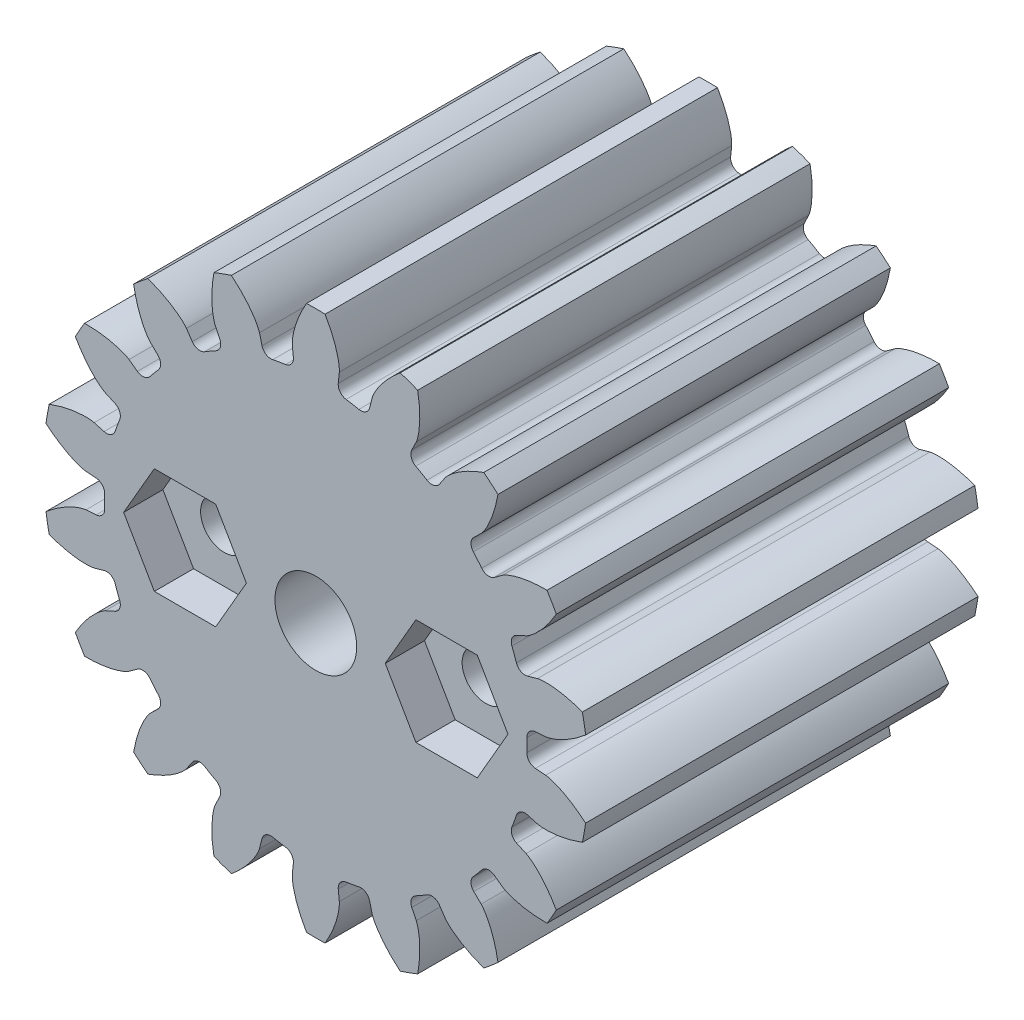
from build123d import *

# Parameters (mm, degrees)
SKETCH3_R                = 10.583333333
BOSS_EXTRUDE1_DEPTH      = 15.24
CUT_EXTRUDE1_DEPTH       = 22.360512374
FILLET1_R                = 0.355076163
CIRPATTERN1_COUNT        = 18
FILLET1_OF_CIRPATTERN1_R = 0.355076163
SCALE3_SCALE             = 2
SKETCH10_R               = 3.175
CUT_EXTRUDE4_DEPTH       = 7.62
SKETCH11_R               = 3.048
CUT_EXTRUDE5_DEPTH       = 2.54
CUT_EXTRUDE6_DEPTH       = 3.048
SKETCH14_R               = 1.8415
CUT_EXTRUDE7_DEPTH       = 12.7


with BuildPart() as part:
    # Sketch3 → Boss-Extrude1 (new body)
    with BuildSketch(Plane.XY):
        Circle(SKETCH3_R)
    extrude(amount=-BOSS_EXTRUDE1_DEPTH)

    # Sketch4 → Cut-Extrude1 (cut, symmetric)
    with BuildSketch(Plane.XY):
        with BuildLine():
            Line((8.180618539, 0.593001964), (8.927148628, 0.647116919))
            add(Edge.make_bspline(
                [(8.927148628, 0.647116919), (8.929773603, 0.64734246), (8.937126743, 0.648083571), (8.950989701, 0.649913095), (8.97354406, 0.653505718), (9.002174883, 0.658974713), (9.039040294, 0.667064652), (9.08227108, 0.677905244), (9.129552823, 0.691187893), (9.180725702, 0.707111733), (9.231524372, 0.724296782), (9.281946361, 0.742644429), (9.331936661, 0.762005639), (9.392192531, 0.786734306), (9.464019144, 0.81815733), (9.547307729, 0.857451379), (9.640949476, 0.905033405), (9.735448155, 0.956729189), (9.827643658, 1.01022152), (9.919826595, 1.067258688), (10.008328253, 1.124562674), (10.099192996, 1.187113225), (10.182530598, 1.246394384), (10.274659666, 1.316128649), (10.348652098, 1.373376845), (10.424010343, 1.435256389), (10.460526963, 1.465776942), (10.479120716, 1.481544284)],
                knots=[0, 0, 0, 0, 0, 0.005376749, 0.015083688, 0.02853182, 0.04661014, 0.064854849, 0.092110526, 0.119476176, 0.146842496, 0.174208854, 0.201574956, 0.228941013, 0.256307345, 0.307035032, 0.361767352, 0.416499661, 0.471231937, 0.525964282, 0.580696616, 0.635428982, 0.690161387, 0.744893688, 0.799626082, 0.854358407, 0.909090915, 0.909090915, 0.909090915, 0.909090915, 0.909090915], degree=4))
            ThreePointArc((10.479120716, 1.481544284), (10.583333333, 0), (10.479120716, -1.481544284))
            add(Edge.make_bspline(
                [(8.927148628, -0.647116919), (8.929773603, -0.64734246), (8.937126743, -0.648083571), (8.950989701, -0.649913095), (8.97354406, -0.653505718), (9.002174883, -0.658974713), (9.039040294, -0.667064652), (9.08227108, -0.677905244), (9.129552823, -0.691187893), (9.180725702, -0.707111733), (9.231524372, -0.724296782), (9.281946361, -0.742644429), (9.331936661, -0.762005639), (9.392192531, -0.786734306), (9.464019144, -0.81815733), (9.547307729, -0.857451379), (9.640949476, -0.905033405), (9.735448155, -0.956729189), (9.827643658, -1.01022152), (9.919826595, -1.067258688), (10.008328253, -1.124562674), (10.099192996, -1.187113225), (10.182530598, -1.246394384), (10.274659666, -1.316128649), (10.348652098, -1.373376845), (10.424010343, -1.435256389), (10.460526963, -1.465776942), (10.479120716, -1.481544284)],
                knots=[0, 0, 0, 0, 0, 0.005376749, 0.015083688, 0.02853182, 0.04661014, 0.064854849, 0.092110526, 0.119476176, 0.146842496, 0.174208854, 0.201574956, 0.228941013, 0.256307345, 0.307035032, 0.361767352, 0.416499661, 0.471231937, 0.525964282, 0.580696616, 0.635428982, 0.690161387, 0.744893688, 0.799626082, 0.854358407, 0.909090915, 0.909090915, 0.909090915, 0.909090915, 0.909090915], degree=4))
            Line((8.927148628, -0.647116919), (8.180618539, -0.593001964))
            ThreePointArc((8.180618539, -0.593001964), (8.202083333, 0), (8.180618539, 0.593001964))
        make_face()
    cut_extrude1 = extrude(amount=CUT_EXTRUDE1_DEPTH, both=True, mode=Mode.SUBTRACT)

    # Fillet1
    fillet1_edges = [part.edges().sort_by_distance(p)[0] for p in [
        (8.180618539, -0.593001964, -7.62),
        (8.180618539, 0.593001964, -7.62),
    ]]
    fillet(fillet1_edges, radius=FILLET1_R)

    # CirPattern1: Cut-Extrude1 ×18 about axis
    cirpattern1_axis = Axis((0, 0, 6.35), (0, 0, -1))
    for i in range(1, CIRPATTERN1_COUNT):
        add(cut_extrude1.rotate(cirpattern1_axis, i * 360 / CIRPATTERN1_COUNT), mode=Mode.SUBTRACT)

    # Fillet1 of CirPattern1
    fillet1_of_cirpattern1_edges = [part.edges().sort_by_distance(p)[0] for p in [
        (7.484448258, -3.355175895, -7.62),
        (7.890085491, -2.240696756, -7.62),
        (5.885543058, -5.712666095, -7.62),
        (6.647891688, -4.804134377, -7.62),
        (3.576754504, -7.381124455, -7.62),
        (4.603864035, -6.788122491, -7.62),
        (0.83655657, -8.159310272, -7.62),
        (2.004542433, -7.953362851, -7.62),
        (-2.004542433, -7.953362851, -7.62),
        (-0.83655657, -8.159310272, -7.62),
        (-4.603864035, -6.788122491, -7.62),
        (-3.576754504, -7.381124455, -7.62),
        (-6.647891688, -4.804134377, -7.62),
        (-5.885543058, -5.712666095, -7.62),
        (-7.890085491, -2.240696756, -7.62),
        (-7.484448258, -3.355175895, -7.62),
        (-8.180618539, 0.593001964, -7.62),
        (-8.180618539, -0.593001964, -7.62),
        (-7.484448258, 3.355175895, -7.62),
        (-7.890085491, 2.240696756, -7.62),
        (-5.885543058, 5.712666095, -7.62),
        (-6.647891688, 4.804134377, -7.62),
        (-3.576754504, 7.381124455, -7.62),
        (-4.603864035, 6.788122491, -7.62),
        (-0.83655657, 8.159310272, -7.62),
        (-2.004542433, 7.953362851, -7.62),
        (2.004542433, 7.953362851, -7.62),
        (0.83655657, 8.159310272, -7.62),
        (4.603864035, 6.788122491, -7.62),
        (3.576754504, 7.381124455, -7.62),
        (6.647891688, 4.804134377, -7.62),
        (5.885543058, 5.712666095, -7.62),
        (7.890085491, 2.240696756, -7.62),
        (7.484448258, 3.355175895, -7.62),
    ]]
    fillet(fillet1_of_cirpattern1_edges, radius=FILLET1_OF_CIRPATTERN1_R)


with BuildPart() as part_1:
    # Scale3: scaled about (0, 0, 0)
    add(part.part.scale(SCALE3_SCALE))

    # Sketch10 → Cut-Extrude4 (cut)
    with BuildSketch(Plane.XY):
        Circle(SKETCH10_R)
    extrude(amount=-CUT_EXTRUDE4_DEPTH, mode=Mode.SUBTRACT)

    # Sketch11 → Cut-Extrude5 (cut)
    with BuildSketch(Plane(origin=(0, 0, -30.48), x_dir=(-1, 0, 0), z_dir=(0, 0, -1))):
        Circle(SKETCH11_R)
    extrude(amount=-CUT_EXTRUDE5_DEPTH, mode=Mode.SUBTRACT)

    # Sketch13 → Cut-Extrude6 (cut)
    with BuildSketch(Plane.XY):
        Polygon((-5.393973528, 0), (-7.776986764, 4.1275), (-12.543013236, 4.1275), (-14.926026472, 0), (-12.543013236, -4.1275), (-7.776986764, -4.1275), align=None)
        Polygon((14.926026472, 0), (12.543013236, 4.1275), (7.776986764, 4.1275), (5.393973528, 0), (7.776986764, -4.1275), (12.543013236, -4.1275), align=None)
    extrude(amount=-CUT_EXTRUDE6_DEPTH, mode=Mode.SUBTRACT)

    # Sketch14 → Cut-Extrude7 (cut)
    with BuildSketch(Plane.XY.offset(-3.048)):
        with Locations((-10.16, 0)):
            Circle(SKETCH14_R)
        with Locations((10.16, 0)):
            Circle(SKETCH14_R)
    extrude(amount=-CUT_EXTRUDE7_DEPTH, mode=Mode.SUBTRACT)


solid = part_1.part
